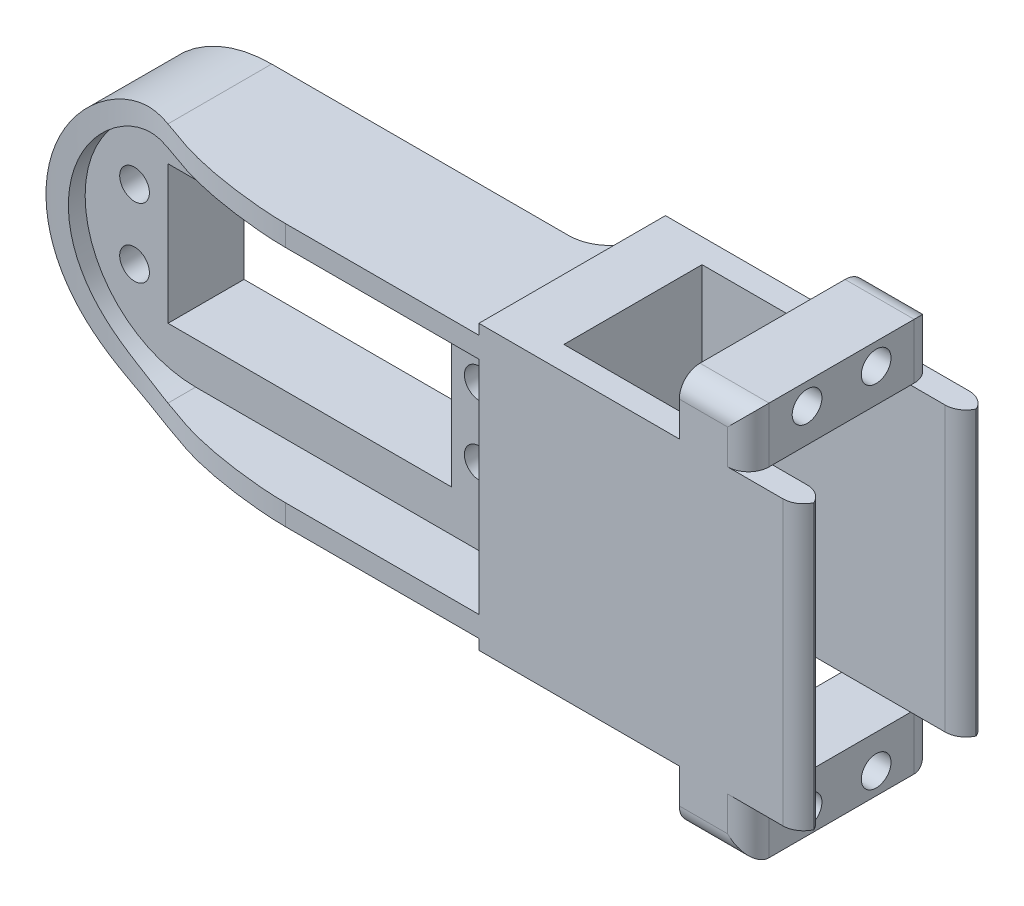
from build123d import *

# Parameters (mm, degrees)
SKETCH1_W               = 120
SKETCH1_H               = 38
SKETCH1_W_2             = 41
SKETCH1_H_2             = 20
BOSS_EXTRUDE1_DEPTH     = 11
FILLET1_RADIUS          = 19
FILLET1_LENGTH          = 11
BOSS_EXTRUDE2_START     = 8
BOSS_EXTRUDE2_DEPTH     = 8
FILLET2_R               = 16
CUT_EXTRUDE2_DEPTH      = 66.741919656
CUT_EXTRUDE2_DEPTH_BACK = 66.741919656
BOSS_EXTRUDE3_START     = 8
BOSS_EXTRUDE3_OUTLINE_W = 32
BOSS_EXTRUDE3_OUTLINE_H = 8
BOSS_EXTRUDE3_DEPTH     = 49
SKETCH8_W               = 52
SKETCH8_H               = 38
BOSS_EXTRUDE4_DEPTH     = 8
SKETCH9_W               = 27
SKETCH9_H               = 38
CUT_EXTRUDE3_DEPTH      = 5
BOSS_EXTRUDE5_START     = -2
SKETCH11_W              = 41
SKETCH11_H              = 20
BOSS_EXTRUDE5_DEPTH     = 2
SKETCH13_R              = 6.5
CUT_EXTRUDE6_DEPTH      = 8
FILLET7_R               = 6
SKETCH25_R              = 2.15
CUT_EXTRUDE13_DEPTH     = 66.741919805
SKETCH10_W              = 38.2
SKETCH10_H              = 20
CUT_EXTRUDE14_DEPTH     = 74.518705262
BOSS_EXTRUDE6_DEPTH     = 1.5
LPATTERN1_COUNT         = 2
LPATTERN1_PITCH         = 39.5
SKETCH27_W              = 10
SKETCH27_H              = 8
BOSS_EXTRUDE7_DEPTH     = 27
FILLET8_R               = 3
CUT_EXTRUDE15_REACH     = 114.349
SKETCH28_R              = 2.15


# Read off the part's stored shape, not the designer's step: Boss-Extrude3
# Some blends are built 0.0001 mm under size
with BuildPart() as part:
    # Sketch1 → Boss-Extrude1 (new body)
    with BuildSketch(Plane.XY):
        Rectangle(SKETCH1_W, SKETCH1_H)
        with Locations((-24.5, 0)):
            Rectangle(SKETCH1_W_2, SKETCH1_H_2, mode=Mode.SUBTRACT)
    extrude(amount=BOSS_EXTRUDE1_DEPTH)

    # Fillet1: full round fillet: the end face becomes a half cylinder, R = half its width
    fillet1_face = Plane((-60, 0, 5.5), x_dir=(0, 0, 1), z_dir=(-1, 0, 0))  # on the end face: x along it, z out of the body
    fillet1_slab = fillet1_face.offset(-FILLET1_RADIUS / 2) * Box(FILLET1_LENGTH, 2 * FILLET1_RADIUS, FILLET1_RADIUS, mode=Mode.PRIVATE)  # the body's end, R deep
    fillet1_round = Plane((-41, 0, 5.5), x_dir=(-1, 0, 0), z_dir=(0, 0, 1)) * Cylinder(FILLET1_RADIUS, FILLET1_LENGTH, mode=Mode.PRIVATE)  # its axis R under the face
    add(fillet1_slab - fillet1_round, mode=Mode.SUBTRACT)

    # Sketch5 → Boss-Extrude2 (add)
    with BuildSketch(Plane.XY.offset(11).offset(BOSS_EXTRUDE2_START)):
        with BuildLine():
            Line((60, 19), (-41, 19))
            ThreePointArc((-41, 19), (-60, 0), (-41, -19))
            Line((-41, -19), (60, -19))
            Line((60, -19), (60, 19))
        make_face()
        with BuildLine():
            Line((57, 16), (-41, 16))
            ThreePointArc((-41, 16), (-57, 0), (-41, -16))
            Line((-41, -16), (57, -16))
            Line((57, -16), (57, 16))
        make_face(mode=Mode.SUBTRACT)
    extrude(amount=-BOSS_EXTRUDE2_DEPTH)

    # Fillet2
    fillet2_edges = [part.edges().sort_by_distance(p)[0] for p in [
        (57, 16, 15),
        (57, -16, 15),
    ]]
    fillet(fillet2_edges, radius=FILLET2_R - 0.0001)  # a hair under: the kernel refuses the full size

    # Sketch6 → Cut-Extrude2 (cut, two sides: drawn at the far end of the back side and taken through both)
    with BuildSketch(Plane(origin=(0, 0, 0), x_dir=(1, 0, 0), z_dir=(0, 1, 0)).offset(-CUT_EXTRUDE2_DEPTH_BACK)):
        with BuildLine():
            add(Edge.make_bspline(
                [(-60, -13.666666667), (-50.023022061, -12.774335398), (-44.35489615, -13.481329797), (-34.284055631, -17.771751053), (-23.960245459, -19), (-20, -19)],
                knots=[0, 0, 0, 0, 0.415410377, 0.639728072, 1, 1, 1, 1], degree=3))
            Line((-20, -19), (-60, -19))
            Line((-60, -19), (-60, -13.666666667))
        make_face()
    extrude(amount=CUT_EXTRUDE2_DEPTH + CUT_EXTRUDE2_DEPTH_BACK, mode=Mode.SUBTRACT)

    # Boss-Extrude3 outline → Boss-Extrude3 (add)
    with BuildSketch(Plane.YZ.offset(BOSS_EXTRUDE3_START)):
        with Locations((0, 15)):
            Rectangle(BOSS_EXTRUDE3_OUTLINE_W, BOSS_EXTRUDE3_OUTLINE_H)
    extrude(amount=BOSS_EXTRUDE3_DEPTH)

    # Sketch8 → Boss-Extrude4 (add)
    with BuildSketch(Plane(origin=(0, 0, 0), x_dir=(-1, 0, 0), z_dir=(0, 0, -1))):
        with Locations((-34, 0)):
            Rectangle(SKETCH8_W, SKETCH8_H)
    extrude(amount=BOSS_EXTRUDE4_DEPTH)

    # Sketch9 → Cut-Extrude3 (cut)
    with BuildSketch(Plane(origin=(60, 0, 0), x_dir=(0, 0, -1), z_dir=(1, 0, 0))):
        with Locations((-5.5, 0)):
            Rectangle(SKETCH9_W, SKETCH9_H)
    extrude(amount=-CUT_EXTRUDE3_DEPTH, mode=Mode.SUBTRACT)

    # Sketch11 → Boss-Extrude5 (add)
    with BuildSketch(Plane(origin=(0, 0, 0), x_dir=(-1, 0, 0), z_dir=(0, 0, -1)).offset(BOSS_EXTRUDE5_START)):
        with BuildLine():
            Line((-8, 19), (-8, -19))
            Line((-8, -19), (41, -19))
            ThreePointArc((41, -19), (60, 0), (41, 19))
            Line((41, 19), (-8, 19))
        make_face()
        with Locations((24.5, 0)):
            Rectangle(SKETCH11_W, SKETCH11_H, mode=Mode.SUBTRACT)
    extrude(amount=BOSS_EXTRUDE5_DEPTH)

    # Sketch13 → Cut-Extrude6 (cut)
    with BuildSketch(Plane(origin=(55, 0, 0), x_dir=(0, 0, -1), z_dir=(1, 0, 0))):
        with Locations(Location((-5.5, 5.3, 0), (0, 0, 90))):
            Circle(SKETCH13_R)
    extrude(amount=-CUT_EXTRUDE6_DEPTH, mode=Mode.SUBTRACT)

    # Fillet7
    fillet7_edges = [part.edges().sort_by_distance(p)[0] for p in [
        (8, 0, 0),
    ]]
    fillet(fillet7_edges, radius=FILLET7_R)

    # Sketch25 → Cut-Extrude13 (cut, through all)
    with BuildSketch(Plane.XY.offset(11)):
        with Locations((-49.85, 5)):
            Circle(SKETCH25_R)
        with Locations((-49.85, -5)):
            Circle(SKETCH25_R)
        with Locations((0.05, -5)):
            Circle(SKETCH25_R)
        with Locations((0.05, 5)):
            Circle(SKETCH25_R)
    extrude(amount=-CUT_EXTRUDE13_DEPTH, mode=Mode.SUBTRACT)

    # Sketch10 → Cut-Extrude14 (cut, through all)
    with BuildSketch(Plane.XZ.offset(19)):
        with Locations((35.9, 5.5)):
            Rectangle(SKETCH10_W, SKETCH10_H)
    extrude(amount=-CUT_EXTRUDE14_DEPTH, mode=Mode.SUBTRACT)

    # Sketch26 → Boss-Extrude6 (add)
    with BuildSketch(Plane.XZ.offset(19)):
        Polygon((8, -8), (55, -8), (55, -4.5), (16.8, -4.5), (16.8, 15.5), (55, 15.5), (55, 19), (8, 19), (8, -6), align=None)
    boss_extrude6 = extrude(amount=BOSS_EXTRUDE6_DEPTH)

    # LPattern1: Boss-Extrude6 ×2
    with Locations(*[(0, i * LPATTERN1_PITCH, 0) for i in range(1, LPATTERN1_COUNT)]):
        add(boss_extrude6)

    # Sketch27 → Boss-Extrude7 (add, through all)
    with BuildSketch(Plane.XY.offset(19)):
        with Locations((42, 24.5)):
            Rectangle(SKETCH27_W, SKETCH27_H)
        with Locations((42, -24.5)):
            Rectangle(SKETCH27_W, SKETCH27_H)
    extrude(amount=-BOSS_EXTRUDE7_DEPTH)

    # Fillet8
    # the kernel refuses this fillet: 3 mm, written as the material it takes off along each edge
    with BuildSketch(Plane(origin=(55, -28, 19), x_dir=(-1, 0, 0), z_dir=(0, 1, 0)), Plane(origin=(55, 28, -8), x_dir=(-1, 0, 0), z_dir=(0, -1, 0)), Plane(origin=(55, -28, 15.5), x_dir=(0, 0, 1), z_dir=(0, 1, 0))) as fillet8_piece_1:
        with BuildLine():
            CenterArc((FILLET8_R, -FILLET8_R), FILLET8_R, 90, 90)
            Line((0, -FILLET8_R), (0, 0))
            Line((0, 0), (FILLET8_R, 0))
        make_face()
    extrude(amount=56, mode=Mode.SUBTRACT)
    with BuildSketch(Plane(origin=(55, 28, -4.5), x_dir=(-1, 0, 0), z_dir=(0, -1, 0))) as fillet8_piece_2:
        with BuildLine():
            CenterArc((FILLET8_R, FILLET8_R), FILLET8_R, 180, 90)
            Line((0, FILLET8_R), (0, 0))
            Line((0, 0), (FILLET8_R, 0))
        make_face()
    extrude(amount=56, mode=Mode.SUBTRACT)
    with BuildSketch(Plane(origin=(47, 36, -8), x_dir=(-1, 0, 0), z_dir=(0, -1, 0)), Plane(origin=(47, -36, 19), x_dir=(-1, 0, 0), z_dir=(0, 1, 0))) as fillet8_piece_3:
        with BuildLine():
            CenterArc((FILLET8_R, -FILLET8_R), FILLET8_R, 90, 90)
            Line((0, -FILLET8_R), (0, 0))
            Line((0, 0), (FILLET8_R, 0))
        make_face()
    extrude(amount=15.5, mode=Mode.SUBTRACT)
    with BuildSketch(Plane(origin=(29.5, 28.5, -8), x_dir=(0, -1, 0), z_dir=(1, 0, 0)), Plane(origin=(29.5, -28.5, 19), x_dir=(0, 1, 0), z_dir=(1, 0, 0))) as fillet8_piece_4:
        with BuildLine():
            CenterArc((FILLET8_R, -FILLET8_R), FILLET8_R, 90, 90)
            Line((0, -FILLET8_R), (0, 0))
            Line((0, 0), (FILLET8_R, 0))
        make_face()
    extrude(amount=25, mode=Mode.SUBTRACT)
    with BuildSketch(Plane(origin=(47, 36, 19), x_dir=(-1, 0, 0), z_dir=(0, -1, 0)), Plane(origin=(47, -36, -8), x_dir=(-1, 0, 0), z_dir=(0, 1, 0))) as fillet8_piece_5:
        with BuildLine():
            CenterArc((FILLET8_R, FILLET8_R), FILLET8_R, 180, 90)
            Line((0, FILLET8_R), (0, 0))
            Line((0, 0), (FILLET8_R, 0))
        make_face()
    extrude(amount=15.5, mode=Mode.SUBTRACT)
    with BuildSketch(Plane(origin=(29.5, 28.5, 19), x_dir=(0, -1, 0), z_dir=(1, 0, 0)), Plane(origin=(29.5, -28.5, -8), x_dir=(0, 1, 0), z_dir=(1, 0, 0))) as fillet8_piece_6:
        with BuildLine():
            CenterArc((FILLET8_R, FILLET8_R), FILLET8_R, 180, 90)
            Line((0, FILLET8_R), (0, 0))
            Line((0, 0), (FILLET8_R, 0))
        make_face()
    extrude(amount=25, mode=Mode.SUBTRACT)

    # Sketch28 → Cut-Extrude15 (cut, up to next)
    with BuildSketch(Plane(origin=(47, 0, 0), x_dir=(0, 0, -1), z_dir=(1, 0, 0)), mode=Mode.PRIVATE) as cut_extrude15_sk1:
        with Locations((-10.5, 25.35)):
            Circle(SKETCH28_R)
    cut_extrude15_tool1 = extrude(cut_extrude15_sk1.sketch, amount=-CUT_EXTRUDE15_REACH, mode=Mode.PRIVATE) & part.part
    # Sketch28 → Cut-Extrude15 (cut, up to next)
    with BuildSketch(Plane(origin=(47, 0, 0), x_dir=(0, 0, -1), z_dir=(1, 0, 0)), mode=Mode.PRIVATE) as cut_extrude15_sk2:
        with Locations((-0.5, 25.35)):
            Circle(SKETCH28_R)
    cut_extrude15_tool2 = extrude(cut_extrude15_sk2.sketch, amount=-CUT_EXTRUDE15_REACH, mode=Mode.PRIVATE) & part.part
    # Sketch28 → Cut-Extrude15 (cut, up to next)
    with BuildSketch(Plane(origin=(47, 0, 0), x_dir=(0, 0, -1), z_dir=(1, 0, 0)), mode=Mode.PRIVATE) as cut_extrude15_sk3:
        with Locations((-0.5, -25.35)):
            Circle(SKETCH28_R)
    cut_extrude15_tool3 = extrude(cut_extrude15_sk3.sketch, amount=-CUT_EXTRUDE15_REACH, mode=Mode.PRIVATE) & part.part
    # Sketch28 → Cut-Extrude15 (cut, up to next)
    with BuildSketch(Plane(origin=(47, 0, 0), x_dir=(0, 0, -1), z_dir=(1, 0, 0)), mode=Mode.PRIVATE) as cut_extrude15_sk4:
        with Locations((-10.5, -25.35)):
            Circle(SKETCH28_R)
    cut_extrude15_tool4 = extrude(cut_extrude15_sk4.sketch, amount=-CUT_EXTRUDE15_REACH, mode=Mode.PRIVATE) & part.part
    add(cut_extrude15_tool1.solids().sort_by_distance((47, 25.35, 10.5))[0], mode=Mode.SUBTRACT)
    add(cut_extrude15_tool2.solids().sort_by_distance((47, 25.35, 0.5))[0], mode=Mode.SUBTRACT)
    add(cut_extrude15_tool3.solids().sort_by_distance((47, -25.35, 0.5))[0], mode=Mode.SUBTRACT)
    add(cut_extrude15_tool4.solids().sort_by_distance((47, -25.35, 10.5))[0], mode=Mode.SUBTRACT)


solid = part.part
